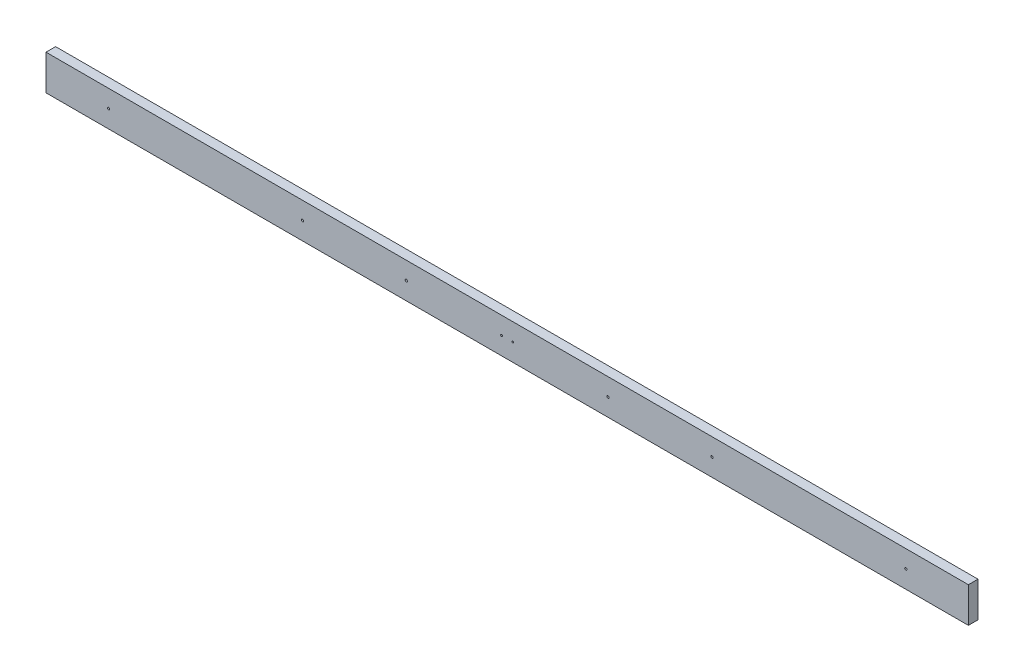
from build123d import *

# Parameters (mm, degrees)
SKETCH1_W           = 3657.6
SKETCH1_H           = 139.7
BOSS_EXTRUDE1_DEPTH = 38.1
SKETCH3_R           = 3.571875
CUT_EXTRUDE2_DEPTH  = 1831.529997706
SKETCH5_R           = 4.49961
CUT_EXTRUDE3_DEPTH  = 1831.529997706
SKETCH6_R           = 4.4996
CUT_EXTRUDE4_DEPTH  = 1831.529997706


with BuildPart() as part:
    # Sketch1 → Boss-Extrude1 (new body)
    with BuildSketch(Plane.XY):
        Rectangle(SKETCH1_W, SKETCH1_H)
    extrude(amount=BOSS_EXTRUDE1_DEPTH)

    # Sketch3 → Cut-Extrude2 (cut, through all)
    with BuildSketch(Plane.XY.offset(38.1)):
        with Locations((-22.225, 0)):
            Circle(SKETCH3_R)
        with Locations((22.225, 0)):
            Circle(SKETCH3_R)
    extrude(amount=-CUT_EXTRUDE2_DEPTH, mode=Mode.SUBTRACT)

    # Sketch5 → Cut-Extrude3 (cut, through all)
    with BuildSketch(Plane.XY.offset(38.1)):
        with Locations((400, 0)):
            Circle(SKETCH5_R)
        with Locations((-400, 0)):
            Circle(SKETCH5_R)
    extrude(amount=-CUT_EXTRUDE3_DEPTH, mode=Mode.SUBTRACT)

    # Sketch6 → Cut-Extrude4 (cut, through all)
    with BuildSketch(Plane.XY.offset(38.1)):
        with Locations((811.94, 0)):
            Circle(SKETCH6_R)
        with Locations((1580.6608, 0)):
            Circle(SKETCH6_R)
        with Locations((-1580.6608, 0)):
            Circle(SKETCH6_R)
        with Locations((-811.94, 0)):
            Circle(SKETCH6_R)
    extrude(amount=-CUT_EXTRUDE4_DEPTH, mode=Mode.SUBTRACT)


solid = part.part
